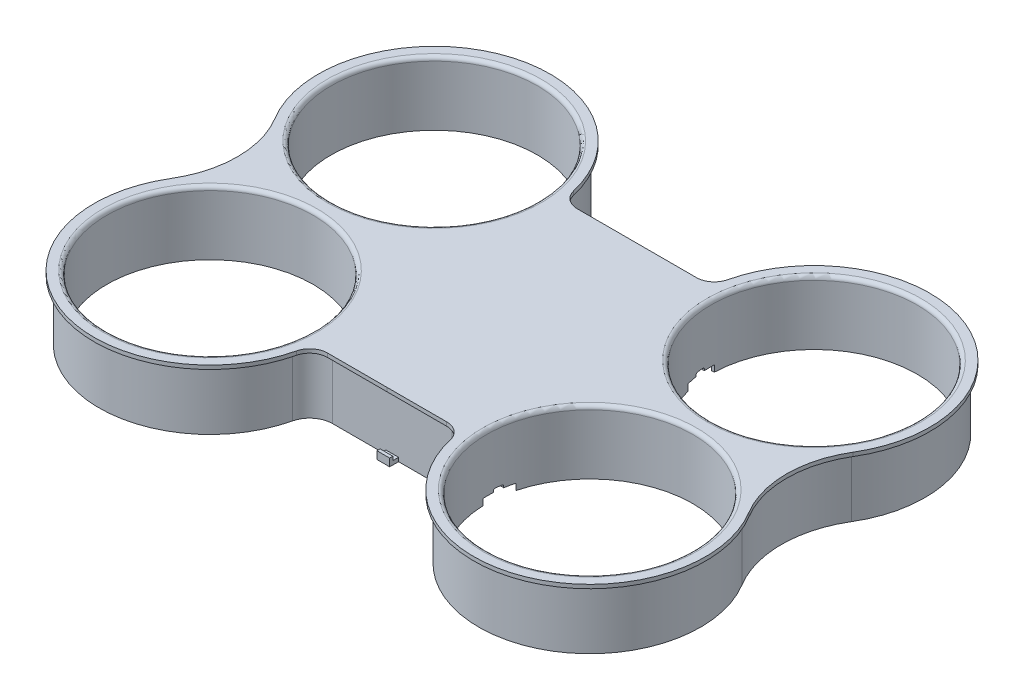
from build123d import *

# Parameters (mm, degrees)
SKETCH1_R            = 40.5
BOSS_EXTRUDE1_DEPTH  = 25
SHELL1_T             = -1
FILLET1_R            = 1.5
SWEEP3_START         = 23.5
SWEEP3_DEPTH         = 1.5
SKETCH11_R           = 1
CUT_EXTRUDE1_DEPTH   = 2.5
BOSS_EXTRUDE2_DEPTH  = 50.5
SKETCH13_W           = 22.44207998
SKETCH13_H           = 92
CUT_EXTRUDE2_DEPTH   = 5
SKETCH14_W           = 2.25
SKETCH14_H           = 1.5
CUT_EXTRUDE3_DEPTH   = 5
SKETCH15_W           = 2.25
SKETCH15_H           = 1.5
CUT_EXTRUDE4_DEPTH   = 5
CUT_EXTRUDE7_DEPTH   = 2.5
MIRROR2_COPY_1_DEPTH = 2.5


# Read off the part's stored shape, not the designer's step: Sweep3
with BuildPart() as part:
    # Sketch1 → Boss-Extrude1 (new body)
    with BuildSketch(Plane(origin=(0, 0, 0), x_dir=(1, 0, 0), z_dir=(0, 1, 0))):
        with BuildLine():
            Line((-23.389824888, -47), (23.389824888, -47))
            ThreePointArc((23.389824888, -47), (28.979355918, -48.946125685), (32.151569193, -53.942857143))
            ThreePointArc((32.151569193, -53.942857143), (90.931692418, -84.277158344), (111.718349922, -21.482352941))
            ThreePointArc((111.718349922, -21.482352941), (105.725511342, 0), (111.718349922, 21.482352941))
            ThreePointArc((111.718349922, 21.482352941), (90.931692418, 84.277158344), (32.151569193, 53.942857143))
            ThreePointArc((32.151569193, 53.942857143), (28.979355918, 48.946125685), (23.389824888, 47))
            Line((23.389824888, 47), (-23.389824888, 47))
            ThreePointArc((-23.389824888, 47), (-28.979355918, 48.946125685), (-32.151569193, 53.942857143))
            ThreePointArc((-32.151569193, 53.942857143), (-90.931692418, 84.277158344), (-111.718349922, 21.482352941))
            ThreePointArc((-111.718349922, 21.482352941), (-105.725511342, 0), (-111.718349922, -21.482352941))
            ThreePointArc((-111.718349922, -21.482352941), (-90.931692418, -84.277158344), (-32.151569193, -53.942857143))
            ThreePointArc((-32.151569193, -53.942857143), (-28.979355918, -48.946125685), (-23.389824888, -47))
        make_face()
        with Locations(Location((74.5, -44, 0), (0, 0, 270))):
            Circle(SKETCH1_R, mode=Mode.SUBTRACT)
        with Locations(Location((74.5, 44, 0), (0, 0, 270))):
            Circle(SKETCH1_R, mode=Mode.SUBTRACT)
        with Locations(Location((-74.5, 44, 0), (0, 0, 270))):
            Circle(SKETCH1_R, mode=Mode.SUBTRACT)
        with Locations(Location((-74.5, -44, 0), (0, 0, 270))):
            Circle(SKETCH1_R, mode=Mode.SUBTRACT)
    extrude(amount=BOSS_EXTRUDE1_DEPTH)

    # Shell1
    shell1_openings = [part.faces().sort_by_distance(p)[0] for p in [
        (0, 0, 0),
    ]]
    offset(amount=SHELL1_T, openings=shell1_openings, kind=Kind.INTERSECTION)

    # Fillet1
    fillet1_edges = [part.edges().sort_by_distance(p)[0] for p in [
        (74.5, 25, 3.5),
        (74.5, 25, -84.5),
        (-74.5, 25, -84.5),
        (-74.5, 25, 3.5),
    ]]
    fillet(fillet1_edges, radius=FILLET1_R)

    # Sweep3 outline → Sweep3 (add)
    with BuildSketch(Plane(origin=(0, 0, 0), x_dir=(1, 0, 0), z_dir=(0, 1, 0)).offset(SWEEP3_START)):
        with BuildLine():
            Line((-23.389824888, -49), (23.389824888, -49))
            ThreePointArc((23.389824888, -49), (27.737237912, -50.51365331), (30.204514903, -54.4))
            ThreePointArc((30.204514903, -54.4), (91.687172529, -86.128981716), (113.429538424, -20.447058824))
            ThreePointArc((113.429538424, -20.447058824), (107.725511342, 0), (113.429538424, 20.447058824))
            ThreePointArc((113.429538424, 20.447058824), (91.687172529, 86.128981716), (30.204514903, 54.4))
            ThreePointArc((30.204514903, 54.4), (27.737237912, 50.51365331), (23.389824888, 49))
            Line((23.389824888, 49), (-23.389824888, 49))
            ThreePointArc((-23.389824888, 49), (-27.737237912, 50.51365331), (-30.204514903, 54.4))
            ThreePointArc((-30.204514903, 54.4), (-91.687172529, 86.128981716), (-113.429538424, 20.447058824))
            ThreePointArc((-113.429538424, 20.447058824), (-107.725511342, 0), (-113.429538424, -20.447058824))
            ThreePointArc((-113.429538424, -20.447058824), (-91.687172529, -86.128981716), (-30.204514903, -54.4))
            ThreePointArc((-30.204514903, -54.4), (-27.737237912, -50.51365331), (-23.389824888, -49))
        make_face()
        with BuildLine():
            ThreePointArc((-111.718349922, -21.482352941), (-105.725511342, 0), (-111.718349922, 21.482352941))
            ThreePointArc((-111.718349922, 21.482352941), (-90.931692418, 84.277158344), (-32.151569193, 53.942857143))
            ThreePointArc((-32.151569193, 53.942857143), (-28.979355918, 48.946125685), (-23.389824888, 47))
            Line((-23.389824888, 47), (23.389824888, 47))
            ThreePointArc((23.389824888, 47), (28.979355918, 48.946125685), (32.151569193, 53.942857143))
            ThreePointArc((32.151569193, 53.942857143), (90.931692418, 84.277158344), (111.718349922, 21.482352941))
            ThreePointArc((111.718349922, 21.482352941), (105.725511342, 0), (111.718349922, -21.482352941))
            ThreePointArc((111.718349922, -21.482352941), (90.931692418, -84.277158344), (32.151569193, -53.942857143))
            ThreePointArc((32.151569193, -53.942857143), (28.979355918, -48.946125685), (23.389824888, -47))
            Line((23.389824888, -47), (-23.389824888, -47))
            ThreePointArc((-23.389824888, -47), (-28.979355918, -48.946125685), (-32.151569193, -53.942857143))
            ThreePointArc((-32.151569193, -53.942857143), (-90.931692418, -84.277158344), (-111.718349922, -21.482352941))
        make_face(mode=Mode.SUBTRACT)
    extrude(amount=SWEEP3_DEPTH)

    # Sketch11 → Cut-Extrude1 (cut)
    with BuildSketch(Plane(origin=(0, 0, 0), x_dir=(1, 0, 0), z_dir=(0, 1, 0))):
        with BuildLine():
            Line((-65.804094654, 48.16007559), (-35.520089861, 45.242499962))
            Line((-35.520089861, 45.242499962), (-35.520089861, 45.556088436))
            Line((-35.520089861, 45.556088436), (-32.476492754, 45.262866823))
            Line((-32.476492754, 45.262866823), (-32.522386179, 45))
            Line((-32.522386179, 45), (32.522386179, 45))
            Line((32.522386179, 45), (32.476492754, 45.262866823))
            Line((32.476492754, 45.262866823), (35.520089861, 45.556088436))
            Line((35.520089861, 45.556088436), (35.520089861, 45.242499962))
            Line((35.520089861, 45.242499962), (65.804094654, 48.16007559))
            ThreePointArc((65.804094654, 48.16007559), (68.314296947, 48.735029299), (70.594434927, 49.931966272))
            ThreePointArc((70.594434927, 49.931966272), (81.979268115, 44.695249474), (71.803564446, 37.381380156))
            ThreePointArc((71.803564446, 37.381380156), (69.336857285, 38.121003778), (66.763059445, 38.206162463))
            Line((66.763059445, 38.206162463), (39.589372855, 35.588236391))
            Line((39.589372855, 35.588236391), (37.816370352, 34.53671057))
            ThreePointArc((37.816370352, 34.53671057), (34.987943227, 33.365137695), (33.816370352, 30.53671057))
            Line((33.816370352, 30.53671057), (32.5, 29.922532664))
            Line((32.5, 29.922532664), (32.5, -29.922532664))
            Line((32.5, -29.922532664), (33.816370352, -30.53671057))
            ThreePointArc((33.816370352, -30.53671057), (34.987943227, -33.365137695), (37.816370352, -34.53671057))
            Line((37.816370352, -34.53671057), (39.589372855, -35.588236391))
            Line((39.589372855, -35.588236391), (66.763059445, -38.206162463))
            ThreePointArc((66.763059445, -38.206162463), (69.336857285, -38.121003778), (71.803564446, -37.381380156))
            ThreePointArc((71.803564446, -37.381380156), (81.979268115, -44.695249474), (70.594434927, -49.931966272))
            ThreePointArc((70.594434927, -49.931966272), (68.314296947, -48.735029299), (65.804094654, -48.16007559))
            Line((65.804094654, -48.16007559), (35.520089861, -45.242499962))
            Line((35.520089861, -45.242499962), (35.520089861, -45.556088436))
            Line((35.520089861, -45.556088436), (32.476492754, -45.262866823))
            Line((32.476492754, -45.262866823), (32.522386179, -45))
            Line((32.522386179, -45), (-32.522386179, -45))
            Line((-32.522386179, -45), (-32.476492754, -45.262866823))
            Line((-32.476492754, -45.262866823), (-35.520089861, -45.556088436))
            Line((-35.520089861, -45.556088436), (-35.520089861, -45.242499962))
            Line((-35.520089861, -45.242499962), (-65.804094654, -48.16007559))
            ThreePointArc((-65.804094654, -48.16007559), (-68.314296947, -48.735029299), (-70.594434927, -49.931966272))
            ThreePointArc((-70.594434927, -49.931966272), (-81.979268115, -44.695249474), (-71.803564446, -37.381380156))
            ThreePointArc((-71.803564446, -37.381380156), (-69.336857285, -38.121003778), (-66.763059445, -38.206162463))
            Line((-66.763059445, -38.206162463), (-39.589372855, -35.588236391))
            Line((-39.589372855, -35.588236391), (-37.816370352, -34.53671057))
            ThreePointArc((-37.816370352, -34.53671057), (-34.987943227, -33.365137695), (-33.816370352, -30.53671057))
            Line((-33.816370352, -30.53671057), (-32.5, -29.922532664))
            Line((-32.5, -29.922532664), (-32.5, 29.922532664))
            Line((-32.5, 29.922532664), (-33.816370352, 30.53671057))
            ThreePointArc((-33.816370352, 30.53671057), (-34.987943227, 33.365137695), (-37.816370352, 34.53671057))
            Line((-37.816370352, 34.53671057), (-39.589372855, 35.588236391))
            Line((-39.589372855, 35.588236391), (-66.763059445, 38.206162463))
            ThreePointArc((-66.763059445, 38.206162463), (-69.336857285, 38.121003778), (-71.803564446, 37.381380156))
            ThreePointArc((-71.803564446, 37.381380156), (-81.979268115, 44.695249474), (-70.594434927, 49.931966272))
            ThreePointArc((-70.594434927, 49.931966272), (-68.314296947, 48.735029299), (-65.804094654, 48.16007559))
        make_face()
        with Locations((-79.262681099, 44)):
            Circle(SKETCH11_R, mode=Mode.SUBTRACT)
        with Locations((79.262681099, -44)):
            Circle(SKETCH11_R, mode=Mode.SUBTRACT)
        with Locations((79.262681099, 44)):
            Circle(SKETCH11_R, mode=Mode.SUBTRACT)
        with Locations((-74.763804713, 48.237135724)):
            Circle(SKETCH11_R, mode=Mode.SUBTRACT)
        with Locations((-70.262681099, 44.000005095)):
            Circle(SKETCH11_R, mode=Mode.SUBTRACT)
        with Locations((-74.762678551, 39.500002547)):
            Circle(SKETCH11_R, mode=Mode.SUBTRACT)
        with Locations((-74.762678551, -39.500002547)):
            Circle(SKETCH11_R, mode=Mode.SUBTRACT)
        with Locations((-70.262681099, -44.000005095)):
            Circle(SKETCH11_R, mode=Mode.SUBTRACT)
        with Locations((-74.763804713, -48.237135724)):
            Circle(SKETCH11_R, mode=Mode.SUBTRACT)
        with Locations((-79.262681099, -44)):
            Circle(SKETCH11_R, mode=Mode.SUBTRACT)
        with Locations((74.763804713, -48.237135724)):
            Circle(SKETCH11_R, mode=Mode.SUBTRACT)
        with Locations((70.262681099, -44.000005095)):
            Circle(SKETCH11_R, mode=Mode.SUBTRACT)
        with Locations((74.762678551, -39.500002547)):
            Circle(SKETCH11_R, mode=Mode.SUBTRACT)
        with Locations((74.762678551, 39.500002547)):
            Circle(SKETCH11_R, mode=Mode.SUBTRACT)
        with Locations((70.262681099, 44.000005095)):
            Circle(SKETCH11_R, mode=Mode.SUBTRACT)
        with Locations((74.763804713, 48.237135724)):
            Circle(SKETCH11_R, mode=Mode.SUBTRACT)
    extrude(amount=CUT_EXTRUDE1_DEPTH, mode=Mode.SUBTRACT)

    # Sketch12 → Boss-Extrude2 (add, symmetric)
    with BuildSketch(Plane.XY):
        Polygon((-2.5, 3), (2.5, 3), (2.5, 0), (0, 0), (-2.5, 0), align=None)
    extrude(amount=BOSS_EXTRUDE2_DEPTH, both=True)

    # Sketch13 → Cut-Extrude2 (cut, symmetric)
    with BuildSketch(Plane(origin=(0, 0, 0), x_dir=(1, 0, 0), z_dir=(0, 1, 0))):
        Rectangle(SKETCH13_W, SKETCH13_H)
    extrude(amount=CUT_EXTRUDE2_DEPTH, both=True, mode=Mode.SUBTRACT)

    # Sketch14 → Cut-Extrude3 (cut)
    with BuildSketch(Plane.ZY.offset(2.5)):
        with Locations((48.125, 2.25)):
            Rectangle(SKETCH14_W, SKETCH14_H)
    extrude(amount=-CUT_EXTRUDE3_DEPTH, mode=Mode.SUBTRACT)

    # Sketch15 → Cut-Extrude4 (cut)
    with BuildSketch(Plane.ZY.offset(2.5)):
        with Locations((-48.125, 2.25)):
            Rectangle(SKETCH15_W, SKETCH15_H)
    extrude(amount=-CUT_EXTRUDE4_DEPTH, mode=Mode.SUBTRACT)

    # 3DSketch1 → Cut-Extrude7 (cut, symmetric, along a direction that is not the sketch's normal)
    with BuildSketch(Plane(origin=(34.884664824, 2.440289925, -37.726404407), x_dir=(-0.10949388638667915, 0.1749416354205602, -0.9784715187680839), z_dir=(0.9937970564916865, -1.5594682165333139e-15, -0.11120885984695511))):
        with BuildLine():
            Line((0, 0), (3.624813767, -0.62634201))
            Line((3.624813767, -0.62634201), (3.73610328, 0))
            ThreePointArc((3.73610328, 0), (3.637298857, 0.448464941), (3.250320978, 0.695712265))
            Line((3.250320978, 0.695712265), (2.018458765, 0.914591636))
            Line((2.018458765, 0.914591636), (0.807047461, 1.112381424))
            ThreePointArc((0.807047461, 1.112381424), (0.35858252, 1.013577001), (0.111335197, 0.626599122))
            Line((0.111335197, 0.626599122), (0, 0))
        make_face()
    cut_extrude7 = extrude(amount=CUT_EXTRUDE7_DEPTH, dir=(1, 0, 0), both=True, mode=Mode.SUBTRACT)

    # Mirror1: Cut-Extrude7 across plane
    add(cut_extrude7.mirror(Plane.XY), mode=Mode.SUBTRACT)

    # Mirror2: Cut-Extrude7 across plane
    add(cut_extrude7.mirror(Plane(origin=(0, 0, 0), x_dir=(0, 0, 1), z_dir=(1, 0, 0))), mode=Mode.SUBTRACT)

    # Mirror2 copy 1 sketch → Mirror2 copy 1 (cut, symmetric, along a direction that is not the sketch's normal)
    with BuildSketch(Plane(origin=(-34.884664824, 2.440289925, 37.726404407), x_dir=(0.10949388638667915, 0.1749416354205602, 0.9784715187680839), z_dir=(-0.9937970564916865, -1.5594682165333139e-15, 0.11120885984695511))):
        with BuildLine():
            Line((0, 0), (3.624813767, -0.62634201))
            Line((3.624813767, -0.62634201), (3.73610328, 0))
            ThreePointArc((3.73610328, 0), (3.637298857, 0.448464941), (3.250320978, 0.695712265))
            Line((3.250320978, 0.695712265), (2.018458765, 0.914591636))
            Line((2.018458765, 0.914591636), (0.807047461, 1.112381424))
            ThreePointArc((0.807047461, 1.112381424), (0.35858252, 1.013577001), (0.111335197, 0.626599122))
            Line((0.111335197, 0.626599122), (0, 0))
        make_face()
    extrude(amount=MIRROR2_COPY_1_DEPTH, dir=(-1, 0, 0), both=True, mode=Mode.SUBTRACT)


solid = part.part
